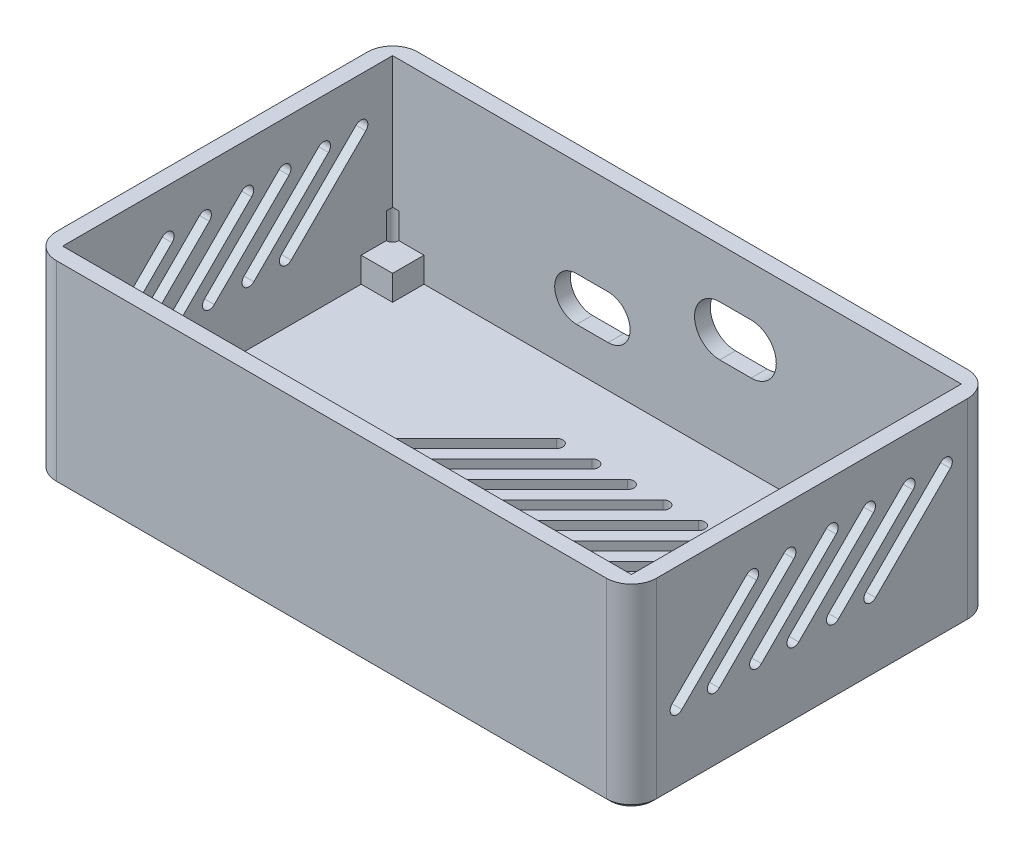
from build123d import *

# Parameters (mm, degrees)
CUERPO_DEPTH                  = 31
CROQUIS_HUECO_PCB_W           = 90.5
CROQUIS_HUECO_PCB_H           = 52.5
HUECO_PCB_DEPTH               = 29
CROQUIS_APOYOS_W              = 5
CROQUIS_APOYOS_H              = 5
APOYOS_PCB_DEPTH              = 4
CROQUIS_ALIVIOS_R             = 1
ALIVIOS_ESQUINAS_DEPTH        = 8.1
SALIDAS_USB_Y_PANEL_DEPTH     = 64.777935056
VENTILAS_LATERALES_DEPTH      = 64.777935056
VENTILAS_LATERALES_DEPTH_BACK = 64.777935056
REJILLA_PISO_DEPTH            = 2
CHAFLAN_BASE_SIZE             = 0.6


with BuildPart() as part:
    # Croquis_contorno → Cuerpo (new body)
    with BuildSketch(Plane(origin=(0, 0, 0), x_dir=(1, 0, 0), z_dir=(0, 1, 0))):
        with BuildLine():
            Line((-43.75, -28.75), (43.75, -28.75))
            ThreePointArc((43.75, -28.75), (46.578427125, -27.578427125), (47.75, -24.75))
            Line((47.75, -24.75), (47.75, 24.75))
            ThreePointArc((47.75, 24.75), (46.578427125, 27.578427125), (43.75, 28.75))
            Line((43.75, 28.75), (-43.75, 28.75))
            ThreePointArc((-43.75, 28.75), (-46.578427125, 27.578427125), (-47.75, 24.75))
            Line((-47.75, 24.75), (-47.75, -24.75))
            ThreePointArc((-47.75, -24.75), (-46.578427125, -27.578427125), (-43.75, -28.75))
        make_face()
    extrude(amount=CUERPO_DEPTH)

    # Croquis_hueco_PCB → Hueco_PCB (cut)
    with BuildSketch(Plane(origin=(0, 31, 0), x_dir=(1, 0, 0), z_dir=(0, 1, 0))):
        Rectangle(CROQUIS_HUECO_PCB_W, CROQUIS_HUECO_PCB_H)
    extrude(amount=-HUECO_PCB_DEPTH, mode=Mode.SUBTRACT)

    # Croquis_apoyos → Apoyos_PCB (add)
    with BuildSketch(Plane(origin=(0, 2, 0), x_dir=(1, 0, 0), z_dir=(0, 1, 0))):
        with Locations((-42.75, -23.75)):
            Rectangle(CROQUIS_APOYOS_W, CROQUIS_APOYOS_H)
        with Locations((-42.75, 23.75)):
            Rectangle(CROQUIS_APOYOS_W, CROQUIS_APOYOS_H)
        with Locations((42.75, -23.75)):
            Rectangle(CROQUIS_APOYOS_W, CROQUIS_APOYOS_H)
        with Locations((42.75, 23.75)):
            Rectangle(CROQUIS_APOYOS_W, CROQUIS_APOYOS_H)
    extrude(amount=APOYOS_PCB_DEPTH)

    # Croquis_alivios → Alivios_esquinas (cut)
    with BuildSketch(Plane(origin=(0, 2, 0), x_dir=(1, 0, 0), z_dir=(0, 1, 0))):
        with Locations((-45.25, -26.25)):
            Circle(CROQUIS_ALIVIOS_R)
        with Locations((-45.25, 26.25)):
            Circle(CROQUIS_ALIVIOS_R)
        with Locations((45.25, -26.25)):
            Circle(CROQUIS_ALIVIOS_R)
        with Locations((45.25, 26.25)):
            Circle(CROQUIS_ALIVIOS_R)
    extrude(amount=ALIVIOS_ESQUINAS_DEPTH, mode=Mode.SUBTRACT)

    # Croquis_salidas → Salidas_USB_y_panel (cut, through all)
    with BuildSketch(Plane.XY):
        with BuildLine():
            Line((6.8, 23.1), (11.8, 23.1))
            ThreePointArc((11.8, 23.1), (15.8, 19.1), (11.8, 15.1))
            Line((11.8, 15.1), (6.8, 15.1))
            ThreePointArc((6.8, 15.1), (2.8, 19.1), (6.8, 23.1))
        make_face()
        with BuildLine():
            Line((-15.96, 15.6), (-10.96, 15.6))
            ThreePointArc((-10.96, 15.6), (-7.46, 12.1), (-10.96, 8.6))
            Line((-10.96, 8.6), (-15.96, 8.6))
            ThreePointArc((-15.96, 8.6), (-19.46, 12.1), (-15.96, 15.6))
        make_face()
    extrude(amount=-SALIDAS_USB_Y_PANEL_DEPTH, mode=Mode.SUBTRACT)

    # Croquis_ventilas → Ventilas_laterales (cut, two sides: drawn at the far end of the back side and taken through both)
    with BuildSketch(Plane(origin=(0, 0, 0), x_dir=(0, 0, -1), z_dir=(1, 0, 0)).offset(-VENTILAS_LATERALES_DEPTH_BACK)):
        with BuildLine():
            Line((-22.273863607, 12.438120497), (-10.394469683, 24.317514421))
            ThreePointArc((-10.394469683, 24.317514421), (-8.838834765, 24.317514421), (-8.838834765, 22.761879503))
            Line((-8.838834765, 22.761879503), (-20.718228689, 10.882485579))
            ThreePointArc((-20.718228689, 10.882485579), (-22.273863607, 10.882485579), (-22.273863607, 12.438120497))
        make_face()
        with BuildLine():
            Line((-16.334166645, 12.438120497), (-4.454772721, 24.317514421))
            ThreePointArc((-4.454772721, 24.317514421), (-2.899137803, 24.317514421), (-2.899137803, 22.761879503))
            Line((-2.899137803, 22.761879503), (-14.778531727, 10.882485579))
            ThreePointArc((-14.778531727, 10.882485579), (-16.334166645, 10.882485579), (-16.334166645, 12.438120497))
        make_face()
        with BuildLine():
            Line((-9.616652224, 12.438120497), (2.2627417, 24.317514421))
            ThreePointArc((2.2627417, 24.317514421), (3.818376618, 24.317514421), (3.818376618, 22.761879503))
            Line((3.818376618, 22.761879503), (-8.061017306, 10.882485579))
            ThreePointArc((-8.061017306, 10.882485579), (-9.616652224, 10.882485579), (-9.616652224, 12.438120497))
        make_face()
        with BuildLine():
            Line((-3.676955262, 12.438120497), (8.202438662, 24.317514421))
            ThreePointArc((8.202438662, 24.317514421), (9.75807358, 24.317514421), (9.75807358, 22.761879503))
            Line((9.75807358, 22.761879503), (-2.121320344, 10.882485579))
            ThreePointArc((-2.121320344, 10.882485579), (-3.676955262, 10.882485579), (-3.676955262, 12.438120497))
        make_face()
        with BuildLine():
            Line((2.61629509, 12.438120497), (14.495689014, 24.317514421))
            ThreePointArc((14.495689014, 24.317514421), (16.051323933, 24.317514421), (16.051323933, 22.761879503))
            Line((16.051323933, 22.761879503), (4.171930009, 10.882485579))
            ThreePointArc((4.171930009, 10.882485579), (2.61629509, 10.882485579), (2.61629509, 12.438120497))
        make_face()
        with BuildLine():
            Line((8.555992052, 12.438120497), (20.435385976, 24.317514421))
            ThreePointArc((20.435385976, 24.317514421), (21.991020895, 24.317514421), (21.991020895, 22.761879503))
            Line((21.991020895, 22.761879503), (10.111626971, 10.882485579))
            ThreePointArc((10.111626971, 10.882485579), (8.555992052, 10.882485579), (8.555992052, 12.438120497))
        make_face()
    extrude(amount=VENTILAS_LATERALES_DEPTH + VENTILAS_LATERALES_DEPTH_BACK, mode=Mode.SUBTRACT)

    # Croquis_rejilla_piso → Rejilla_piso (cut)
    with BuildSketch(Plane(origin=(0, 0, 0), x_dir=(1, 0, 0), z_dir=(0, 1, 0))):
        with BuildLine():
            Line((-38.183766184, -14.142135624), (-8.485281374, 15.556349186))
            ThreePointArc((-8.485281374, 15.556349186), (-7.071067812, 15.556349186), (-7.071067812, 14.142135624))
            Line((-7.071067812, 14.142135624), (-36.769552622, -15.556349186))
            ThreePointArc((-36.769552622, -15.556349186), (-38.183766184, -15.556349186), (-38.183766184, -14.142135624))
        make_face()
        with BuildLine():
            Line((-32.526911935, -14.142135624), (-2.828427125, 15.556349186))
            ThreePointArc((-2.828427125, 15.556349186), (-1.414213562, 15.556349186), (-1.414213562, 14.142135624))
            Line((-1.414213562, 14.142135624), (-31.112698372, -15.556349186))
            ThreePointArc((-31.112698372, -15.556349186), (-32.526911935, -15.556349186), (-32.526911935, -14.142135624))
        make_face()
        with BuildLine():
            Line((-26.870057685, -14.142135624), (2.828427125, 15.556349186))
            ThreePointArc((2.828427125, 15.556349186), (4.242640687, 15.556349186), (4.242640687, 14.142135624))
            Line((4.242640687, 14.142135624), (-25.455844123, -15.556349186))
            ThreePointArc((-25.455844123, -15.556349186), (-26.870057685, -15.556349186), (-26.870057685, -14.142135624))
        make_face()
        with BuildLine():
            Line((-21.213203436, -14.142135624), (8.485281374, 15.556349186))
            ThreePointArc((8.485281374, 15.556349186), (9.899494937, 15.556349186), (9.899494937, 14.142135624))
            Line((9.899494937, 14.142135624), (-19.798989873, -15.556349186))
            ThreePointArc((-19.798989873, -15.556349186), (-21.213203436, -15.556349186), (-21.213203436, -14.142135624))
        make_face()
        with BuildLine():
            Line((-15.556349186, -14.142135624), (14.142135624, 15.556349186))
            ThreePointArc((14.142135624, 15.556349186), (15.556349186, 15.556349186), (15.556349186, 14.142135624))
            Line((15.556349186, 14.142135624), (-14.142135624, -15.556349186))
            ThreePointArc((-14.142135624, -15.556349186), (-15.556349186, -15.556349186), (-15.556349186, -14.142135624))
        make_face()
        with BuildLine():
            Line((-9.899494937, -14.142135624), (19.798989873, 15.556349186))
            ThreePointArc((19.798989873, 15.556349186), (21.213203436, 15.556349186), (21.213203436, 14.142135624))
            Line((21.213203436, 14.142135624), (-8.485281374, -15.556349186))
            ThreePointArc((-8.485281374, -15.556349186), (-9.899494937, -15.556349186), (-9.899494937, -14.142135624))
        make_face()
        with BuildLine():
            Line((-4.242640687, -14.142135624), (25.455844123, 15.556349186))
            ThreePointArc((25.455844123, 15.556349186), (26.870057685, 15.556349186), (26.870057685, 14.142135624))
            Line((26.870057685, 14.142135624), (-2.828427125, -15.556349186))
            ThreePointArc((-2.828427125, -15.556349186), (-4.242640687, -15.556349186), (-4.242640687, -14.142135624))
        make_face()
        with BuildLine():
            Line((1.414213562, -14.142135624), (31.112698372, 15.556349186))
            ThreePointArc((31.112698372, 15.556349186), (32.526911935, 15.556349186), (32.526911935, 14.142135624))
            Line((32.526911935, 14.142135624), (2.828427125, -15.556349186))
            ThreePointArc((2.828427125, -15.556349186), (1.414213562, -15.556349186), (1.414213562, -14.142135624))
        make_face()
        with BuildLine():
            Line((7.071067812, -14.142135624), (36.769552622, 15.556349186))
            ThreePointArc((36.769552622, 15.556349186), (38.183766184, 15.556349186), (38.183766184, 14.142135624))
            Line((38.183766184, 14.142135624), (8.485281374, -15.556349186))
            ThreePointArc((8.485281374, -15.556349186), (7.071067812, -15.556349186), (7.071067812, -14.142135624))
        make_face()
    extrude(amount=REJILLA_PISO_DEPTH, mode=Mode.SUBTRACT)

    # Chaflan_base
    chaflan_base_edges = [part.edges().sort_by_distance(p)[0] for p in [
        (0, 0, 28.75),
        (46.578427125, 0, 27.578427125),
        (47.75, 0, 0),
        (46.578427125, 0, -27.578427125),
        (0, 0, -28.75),
        (-46.578427125, 0, -27.578427125),
        (-47.75, 0, 0),
        (-46.578427125, 0, 27.578427125),
    ]]
    chamfer(chaflan_base_edges, length=CHAFLAN_BASE_SIZE)


solid = part.part
